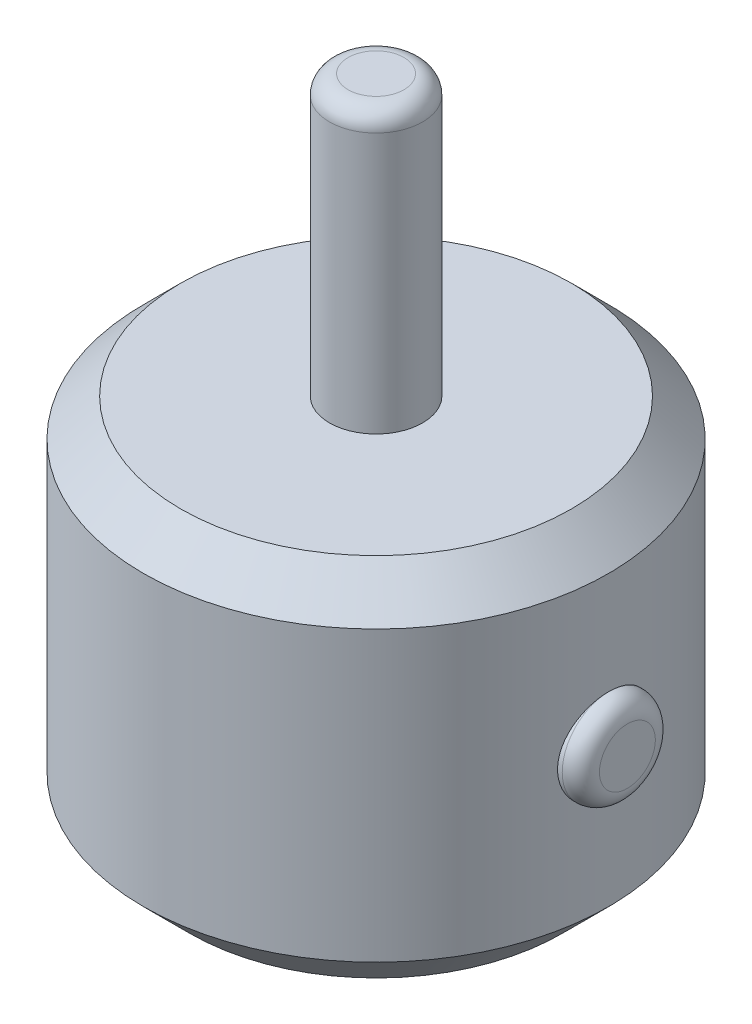
from build123d import *

# Parameters (mm, degrees)
CROQUIS1_R                   = 25
SALIENTE_EXTRUIR1_DEPTH      = 40
CROQUIS2_R                   = 5
SALIENTE_EXTRUIR2_DEPTH      = 30
REDONDEO1_R                  = 2
CHAFL_N1_SIZE                = 4
SALIENTE_EXTRUIR3_DEPTH      = 2
SALIENTE_EXTRUIR3_DEPTH_BACK = 2
CROQUIS3_R                   = 5
CHAFL_N2_SIZE                = 5


with BuildPart() as part:
    # Croquis1 → Saliente-Extruir1 (new body)
    with BuildSketch(Plane(origin=(0, 0, 0), x_dir=(1, 0, 0), z_dir=(0, 1, 0))):
        with Locations(Location((0, 0, 0), (0, 0, 270))):
            Circle(CROQUIS1_R)
    extrude(amount=SALIENTE_EXTRUIR1_DEPTH)

    # Croquis2 → Saliente-Extruir2 (add)
    with BuildSketch(Plane(origin=(0, 40, 0), x_dir=(1, 0, 0), z_dir=(0, 1, 0))):
        with Locations(Location((0, 0, 0), (0, 0, 270))):
            Circle(CROQUIS2_R)
    extrude(amount=SALIENTE_EXTRUIR2_DEPTH)

    # Redondeo1
    redondeo1_edges = [part.edges().sort_by_distance(p)[0] for p in [
        (0, 70, -5),
    ]]
    fillet(redondeo1_edges, radius=REDONDEO1_R)

    # Chaflán1
    chafl_n1_edges = [part.edges().sort_by_distance(p)[0] for p in [
        (0, 40, -25),
    ]]
    chamfer(chafl_n1_edges, length=CHAFL_N1_SIZE)

    # Croquis3 → Saliente-Extruir3 (add, two sides: drawn at the far end of the back side and taken through both)
    with BuildSketch(Plane.ZY.offset(-25).offset(-SALIENTE_EXTRUIR3_DEPTH_BACK)):
        with Locations((0, 20)):
            Circle(CROQUIS3_R)
    extrude(amount=SALIENTE_EXTRUIR3_DEPTH + SALIENTE_EXTRUIR3_DEPTH_BACK)

    # Redondeo3: read off the stored shape, not the designer's step
    # Redondeo3 outline → Redondeo3 (revolve, cut)
    with BuildSketch(Plane(origin=(0, 20, 0), x_dir=(0, 1, 0), z_dir=(0, 0, -1))):
        with BuildLine():
            Line((5, 27), (3, 27))
            ThreePointArc((3, 27), (4.414213562, 26.414213562), (5, 25))
            Line((5, 25), (5, 27))
        make_face()
    revolve(axis=Axis((0, 20, 0), (1, 0, 0)), mode=Mode.SUBTRACT)

    # Chaflán2
    chafl_n2_edges = [part.edges().sort_by_distance(p)[0] for p in [
        (0, 0, -25),
    ]]
    chamfer(chafl_n2_edges, length=CHAFL_N2_SIZE)


solid = part.part
